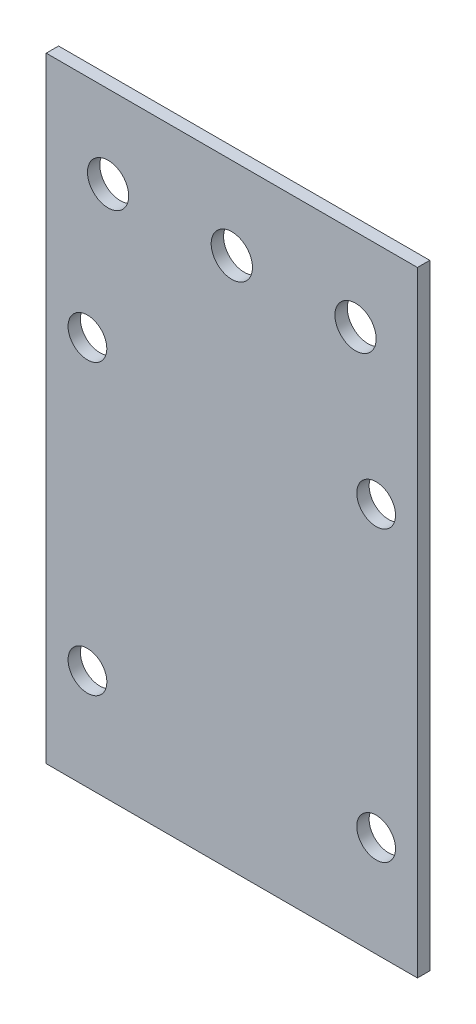
from build123d import *

# Parameters (mm, degrees)
SKETCH1_R           = 2.350480947
BOSS_EXTRUDE1_DEPTH = 1.5
CUT_EXTRUDE1_REACH  = 52.196
SKETCH2_R           = 2.5


with BuildPart() as part:
    # Sketch1 → Boss-Extrude1 (new body)
    with BuildSketch(Plane.XY):
        Polygon((-22.5, 29.75), (-22.5, -29.75), (22.5, -29.75), (22.5, 29.75), (22.5, 44.846109292), (-22.5, 44.846109292), align=None)
        with Locations((-17.503755709, 17.495628345)):
            Circle(SKETCH1_R, mode=Mode.SUBTRACT)
        with Locations((17.496244291, 17.495628345)):
            Circle(SKETCH1_R, mode=Mode.SUBTRACT)
        with Locations((17.496244291, -17.504371655)):
            Circle(SKETCH1_R, mode=Mode.SUBTRACT)
        with Locations((-17.5, -17.5)):
            Circle(SKETCH1_R, mode=Mode.SUBTRACT)
    extrude(amount=BOSS_EXTRUDE1_DEPTH)

    # Sketch2 → Cut-Extrude1 (cut, up to next)
    with BuildSketch(Plane.XY.offset(1.5), mode=Mode.PRIVATE) as cut_extrude1_sk1:
        with Locations((-15, 34.846109292)):
            Circle(SKETCH2_R)
    cut_extrude1_tool1 = extrude(cut_extrude1_sk1.sketch, amount=-CUT_EXTRUDE1_REACH, mode=Mode.PRIVATE) & part.part
    # Sketch2 → Cut-Extrude1 (cut, up to next)
    with BuildSketch(Plane.XY.offset(1.5), mode=Mode.PRIVATE) as cut_extrude1_sk2:
        with Locations((0, 34.846109292)):
            Circle(SKETCH2_R)
    cut_extrude1_tool2 = extrude(cut_extrude1_sk2.sketch, amount=-CUT_EXTRUDE1_REACH, mode=Mode.PRIVATE) & part.part
    # Sketch2 → Cut-Extrude1 (cut, up to next)
    with BuildSketch(Plane.XY.offset(1.5), mode=Mode.PRIVATE) as cut_extrude1_sk3:
        with Locations((15, 34.846109292)):
            Circle(SKETCH2_R)
    cut_extrude1_tool3 = extrude(cut_extrude1_sk3.sketch, amount=-CUT_EXTRUDE1_REACH, mode=Mode.PRIVATE) & part.part
    add(cut_extrude1_tool1.solids().sort_by_distance((-15, 34.846109, 1.5))[0], mode=Mode.SUBTRACT)
    add(cut_extrude1_tool2.solids().sort_by_distance((0, 34.846109, 1.5))[0], mode=Mode.SUBTRACT)
    add(cut_extrude1_tool3.solids().sort_by_distance((15, 34.846109, 1.5))[0], mode=Mode.SUBTRACT)


solid = part.part
